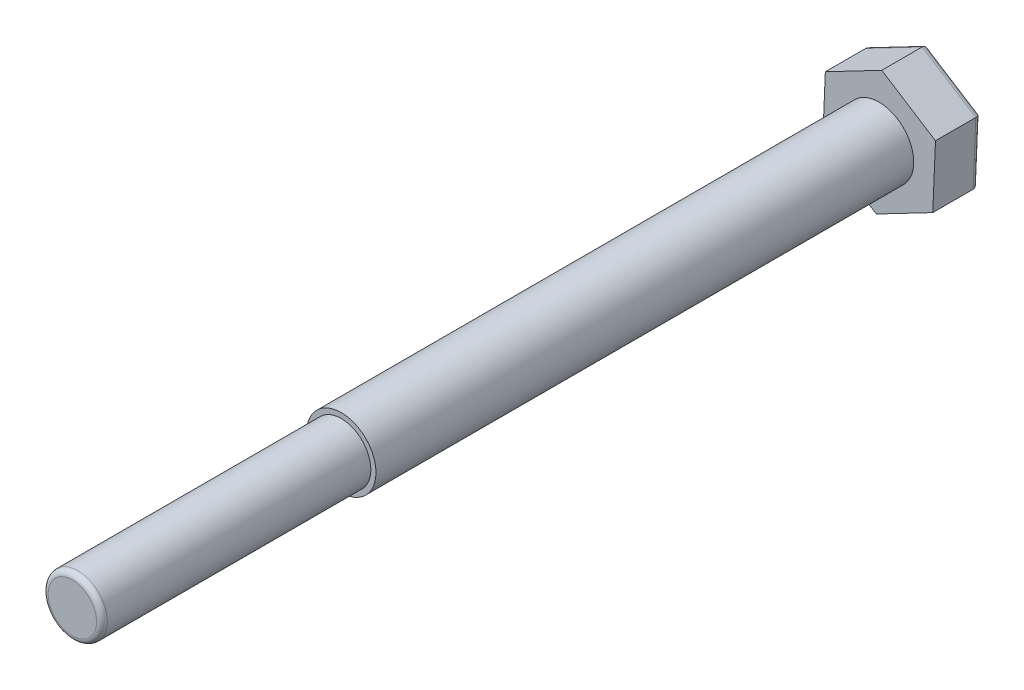
from build123d import *

# Parameters (mm, degrees)
EXTRUDE_311_DEPTH = 17
SKETCH_2_R        = 12.9
EXTRUDE_1_DEPTH   = 200
FILLET_3_R        = 2
SKETCH_3_R        = 11
EXTRUDE_2_DEPTH   = 100
FILLET_4_R        = 2


with BuildPart() as part:
    # 草图1 → Extrude 311 (new body)
    with BuildSketch(Plane.XY):
        Polygon((20.984201837, 10.954296262), (1.005402075, 23.65), (-19.978799762, 12.695703738), (-20.984201837, -10.954296262), (-1.005402075, -23.65), (19.978799762, -12.695703738), align=None)
    extrude(amount=EXTRUDE_311_DEPTH)

    # 草图2 → 凸台-拉伸1 (add)
    with BuildSketch(Plane.XY.offset(17)):
        Circle(SKETCH_2_R)
    extrude(amount=EXTRUDE_1_DEPTH)

    # 圆角3
    fillet_3_edges = [part.edges().sort_by_distance(p)[0] for p in [
        (10.994801956, 17.302148131, 0),
        (-9.486698843, 18.172851869, 0),
        (-20.4815008, 0.870703738, 0),
        (-10.994801956, -17.302148131, 0),
        (9.486698843, -18.172851869, 0),
        (20.4815008, -0.870703738, 0),
    ]]
    fillet(fillet_3_edges, radius=FILLET_3_R)

    # 草图3 → 凸台-拉伸2 (add)
    with BuildSketch(Plane.XY.offset(217)):
        Circle(SKETCH_3_R)
    extrude(amount=EXTRUDE_2_DEPTH)

    # 圆角4
    fillet_4_edges = [part.edges().sort_by_distance(p)[0] for p in [
        (-11, 0, 317),
    ]]
    fillet(fillet_4_edges, radius=FILLET_4_R)


solid = part.part
